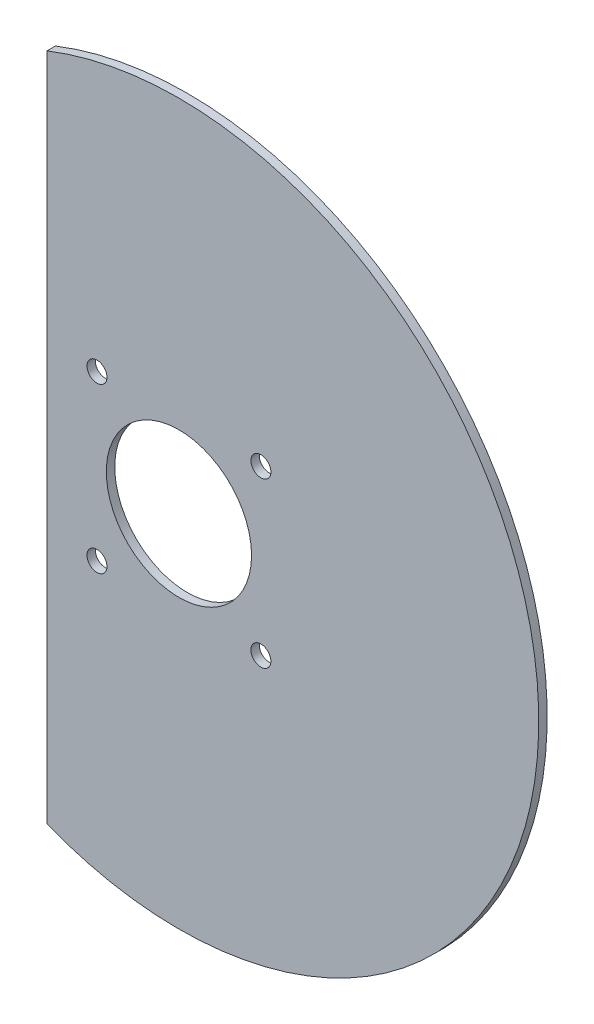
from build123d import *

# Parameters (mm, degrees)
SKETCH1_R          = 55.75
SKETCH1_R_2        = 11.25
EXTRUDE1_DEPTH     = 1.3
SKETCH2_R          = 1.55
CUT_EXTRUDE1_DEPTH = 79.853122957
CUT_EXTRUDE2_DEPTH = 79.853122957


with BuildPart() as part:
    # Sketch1 → Extrude1 (new body)
    with BuildSketch(Plane.XY):
        Circle(SKETCH1_R)
        Circle(SKETCH1_R_2, mode=Mode.SUBTRACT)
    extrude(amount=EXTRUDE1_DEPTH)

    # Sketch2 → Cut-Extrude1 (cut, through all)
    with BuildSketch(Plane.XY.offset(1.3)):
        with Locations((12.7, -12.7)):
            Circle(SKETCH2_R)
        with Locations((12.7, 12.7)):
            Circle(SKETCH2_R)
        with Locations((-12.7, 12.7)):
            Circle(SKETCH2_R)
        with Locations((-12.7, -12.7)):
            Circle(SKETCH2_R)
    extrude(amount=-CUT_EXTRUDE1_DEPTH, mode=Mode.SUBTRACT)

    # Sketch3 → Cut-Extrude2 (cut, through all)
    with BuildSketch(Plane.XY.offset(1.3)):
        with BuildLine():
            Line((-20.441556403, 51.867188779), (-20.441556403, -51.867188779))
            ThreePointArc((-20.441556403, -51.867188779), (-55.75, 0), (-20.441556403, 51.867188779))
        make_face()
    extrude(amount=-CUT_EXTRUDE2_DEPTH, mode=Mode.SUBTRACT)


solid = part.part
